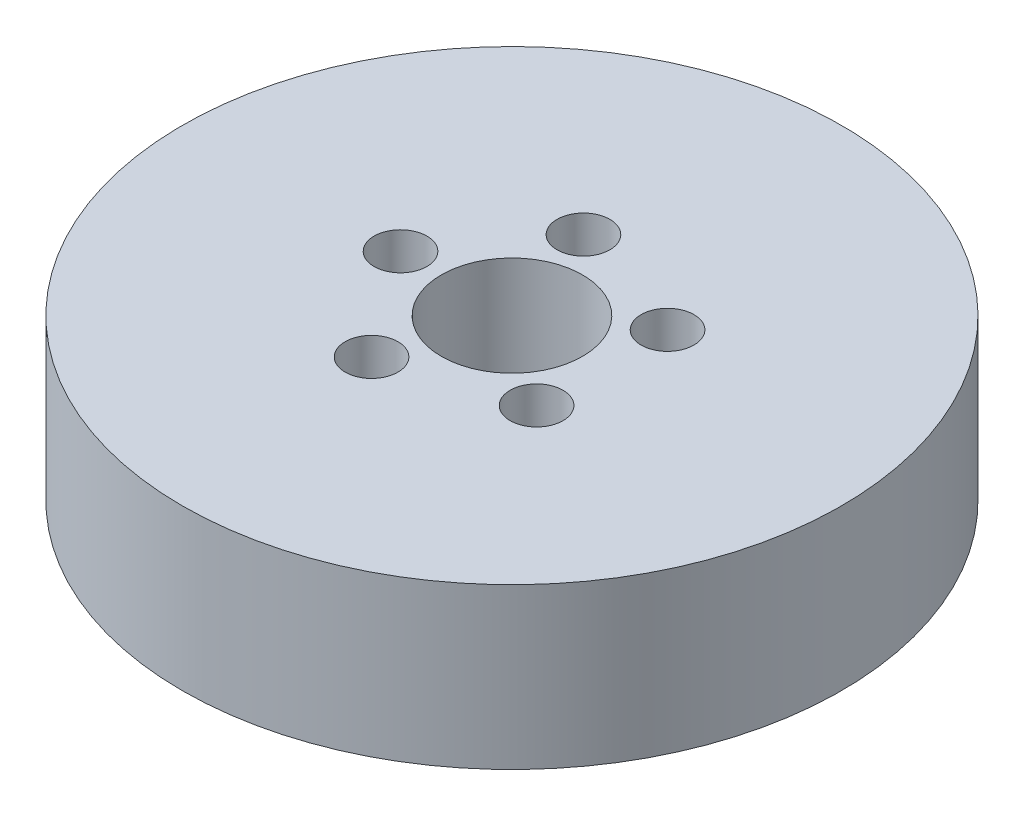
from build123d import *

# Parameters (mm, degrees)
SKETCH1_R           = 35
BOSS_EXTRUDE1_DEPTH = 17
SKETCH2_R           = 7.5
CUT_EXTRUDE1_DEPTH  = 53.335456433
SKETCH3_R           = 2.805332045
CUT_EXTRUDE2_DEPTH  = 16.663981685
CIRPATTERN1_COUNT   = 5


with BuildPart() as part:
    # Sketch1 → Boss-Extrude1 (new body)
    with BuildSketch(Plane(origin=(0, 0, 0), x_dir=(1, 0, 0), z_dir=(0, 1, 0))):
        Circle(SKETCH1_R)
    extrude(amount=BOSS_EXTRUDE1_DEPTH)

    # Sketch2 → Cut-Extrude1 (cut, through all)
    with BuildSketch(Plane(origin=(0, 0, 0), x_dir=(1, 0, 0), z_dir=(0, 1, 0))):
        Circle(SKETCH2_R)
    extrude(amount=CUT_EXTRUDE1_DEPTH, mode=Mode.SUBTRACT)

    # Sketch3 → Cut-Extrude2 (cut)
    with BuildSketch(Plane(origin=(0, 17, 0), x_dir=(1, 0, 0), z_dir=(0, 1, 0))):
        with Locations((-11.830241144, 0)):
            Circle(SKETCH3_R)
    cut_extrude2 = extrude(amount=-CUT_EXTRUDE2_DEPTH, mode=Mode.SUBTRACT)

    # CirPattern1: Cut-Extrude2 ×5 about axis
    cirpattern1_axis = Axis((0, 0, 0), (0, 1, 0))
    for i in range(1, CIRPATTERN1_COUNT):
        add(cut_extrude2.rotate(cirpattern1_axis, i * 360 / CIRPATTERN1_COUNT), mode=Mode.SUBTRACT)


solid = part.part
